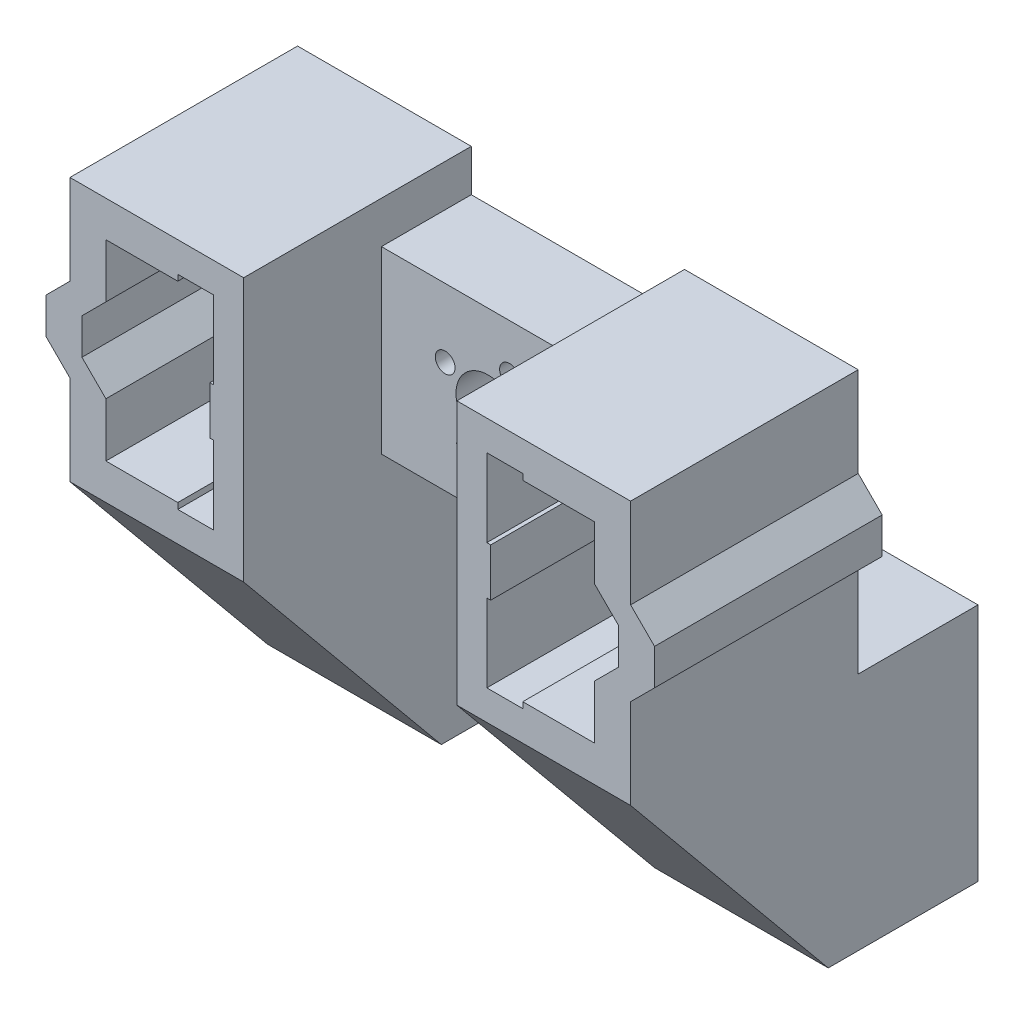
from build123d import *

# Parameters (mm, degrees)
CROQUIS1_R               = 6
SALIENTE_EXTRUIR1_DEPTH  = 38
CROQUIS4_R               = 4.75
SALIENTE_EXTRUIR3_DEPTH  = 5
CROQUIS7_R               = 6
CROQUIS7_R_2             = 5.35
SALIENTE_EXTRUIR4_DEPTH  = 38
CROQUIS8_R               = 1.65
CORTAR_EXTRUIR3_DEPTH    = 38
CROQUIS9_W               = 35.6
CROQUIS9_H               = 23
CORTAR_EXTRUIR4_DEPTH    = 74.441405215
CROQUIS10_W              = 93.6
CROQUIS10_H              = 5
SALIENTE_EXTRUIR5_DEPTH  = 40
CROQUIS11_R              = 2.25
CORTAR_EXTRUIR5_DEPTH    = 87.681255182
CROQUIS14_R              = 2.25
SALIENTE_EXTRUIR6_DEPTH  = 20
SALIENTE_EXTRUIR7_START  = -29
SALIENTE_EXTRUIR7_DEPTH  = 29
SALIENTE_EXTRUIR8_START  = -29
SALIENTE_EXTRUIR8_DEPTH  = 29
CROQUIS17_W              = 35.6
CROQUIS17_H              = 10
CORTAR_EXTRUIR6_DEPTH    = 40
CROQUIS23_W              = 45.6
CROQUIS23_H              = 10
SALIENTE_EXTRUIR11_DEPTH = 8
CORTAR_EXTRUIR7_DEPTH    = 104.464776615
REDONDEO4_R              = 10
SALIENTE_EXTRUIR12_DEPTH = 35.6


with BuildPart() as part:
    # Croquis1 → Saliente-Extruir1 (new body)
    with BuildSketch(Plane.XY):
        Polygon((-50.8, -3), (-50.8, 3), (-46.8, 7), (-46.8, 22), (-17.8, 22), (-17.8, 15), (17.8, 15), (17.8, 22), (46.8, 22), (46.8, 7), (50.8, 3), (50.8, -3), (46.8, -7), (46.8, -22), (17.8, -22), (17.8, -15), (-17.8, -15), (-17.8, -22), (-46.8, -22), (-46.8, -7), align=None)
        Circle(CROQUIS1_R, mode=Mode.SUBTRACT)
        Polygon((-22.8, 4), (-23.45, 4), (-23.45, -4), (-22.8, -4), (-22.8, -17), (-28.8, -17), (-28.8, -16), (-40.8, -16), (-40.8, -7), (-44.8, -3), (-44.8, 3), (-40.8, 7), (-40.8, 16), (-28.8, 16), (-28.8, 17), (-22.8, 17), align=None, mode=Mode.SUBTRACT)
        Polygon((23.45, -4), (23.45, 4), (22.8, 4), (22.8, 17), (28.8, 17), (28.8, 16), (40.8, 16), (40.8, 7), (44.8, 3), (44.8, -3), (40.8, -7), (40.8, -16), (28.8, -16), (28.8, -17), (22.8, -17), (22.8, -4), align=None, mode=Mode.SUBTRACT)
    extrude(amount=SALIENTE_EXTRUIR1_DEPTH)

    # Croquis4 → Saliente-Extruir3 (add)
    # profile 1 of 2: a face of its own
    with BuildSketch(Plane(origin=(0, 0, 0), x_dir=(-1, 0, 0), z_dir=(0, 0, -1))):
        Polygon((-40.8, 16), (-28.8, 16), (-28.8, 17), (-22.8, 17), (-22.8, 4), (-23.45, 4), (-23.45, -4), (-22.8, -4), (-22.8, -17), (-28.8, -17), (-28.8, -16), (-40.8, -16), (-40.8, -7), (-44.8, -3), (-44.8, 3), (-40.8, 7), align=None)
        with Locations((-33.8, 0)):
            Circle(CROQUIS4_R, mode=Mode.SUBTRACT)
    # profile 2 of 2: a face of its own
    with BuildSketch(Plane(origin=(0, 0, 0), x_dir=(-1, 0, 0), z_dir=(0, 0, -1))):
        Polygon((40.8, 7), (40.8, 16), (28.8, 16), (28.8, 17), (22.8, 17), (22.8, 4), (23.45, 4), (23.45, -4), (22.8, -4), (22.8, -17), (28.8, -17), (28.8, -16), (40.8, -16), (40.8, -7), (44.8, -3), (44.8, 3), align=None)
        with Locations(Location((33.8, 0, 0), (0, 0, 180))):
            Circle(CROQUIS4_R, mode=Mode.SUBTRACT)
    extrude(amount=-SALIENTE_EXTRUIR3_DEPTH)

    # Croquis7 → Saliente-Extruir4 (add)
    with BuildSketch(Plane(origin=(0, 0, 0), x_dir=(-1, 0, 0), z_dir=(0, 0, -1))):
        Circle(CROQUIS7_R)
        Circle(CROQUIS7_R_2, mode=Mode.SUBTRACT)
    extrude(amount=-SALIENTE_EXTRUIR4_DEPTH)

    # Croquis8 → Cortar-Extruir3 (cut)
    with BuildSketch(Plane(origin=(0, 0, 0), x_dir=(-1, 0, 0), z_dir=(0, 0, -1))):
        with Locations((-7.15441776, -3.579707868)):
            Circle(CROQUIS8_R)
        with Locations((3.579707868, -7.15441776)):
            Circle(CROQUIS8_R)
        with Locations((7.15441776, 3.579707868)):
            Circle(CROQUIS8_R)
        with Locations((-3.579707868, 7.15441776)):
            Circle(CROQUIS8_R)
    extrude(amount=-CORTAR_EXTRUIR3_DEPTH, mode=Mode.SUBTRACT)

    # Croquis9 → Cortar-Extruir4 (cut, through all)
    with BuildSketch(Plane.XZ.offset(15)):
        with Locations((0, 26.5)):
            Rectangle(CROQUIS9_W, CROQUIS9_H)
    extrude(amount=-CORTAR_EXTRUIR4_DEPTH, mode=Mode.SUBTRACT)

    # Croquis10 → Saliente-Extruir5 (add)
    with BuildSketch(Plane.XZ.offset(22)):
        with Locations((0, 2.5)):
            Rectangle(CROQUIS10_W, CROQUIS10_H)
    extrude(amount=SALIENTE_EXTRUIR5_DEPTH)

    # Croquis11 → Cortar-Extruir5 (cut, through all)
    with BuildSketch(Plane.XY.offset(5)):
        with Locations((0, -35)):
            Circle(CROQUIS11_R)
        with Locations((0, -49)):
            Circle(CROQUIS11_R)
    extrude(amount=-CORTAR_EXTRUIR5_DEPTH, mode=Mode.SUBTRACT)

    # Croquis14 → Saliente-Extruir6 (add)
    with BuildSketch(Plane(origin=(0, 0, 0), x_dir=(-1, 0, 0), z_dir=(0, 0, -1))):
        Polygon((17.8, -22), (46.8, -22), (46.8, -62), (-46.8, -62), (-46.8, -22), align=None)
        with Locations(Location((0, -35, 0), (0, 0, 180))):
            Circle(CROQUIS14_R, mode=Mode.SUBTRACT)
        with Locations(Location((0, -49, 0), (0, 0, 180))):
            Circle(CROQUIS14_R, mode=Mode.SUBTRACT)
    extrude(amount=SALIENTE_EXTRUIR6_DEPTH)

    # Croquis15 → Saliente-Extruir7 (add)
    with BuildSketch(Plane.ZY.offset(46.8).offset(SALIENTE_EXTRUIR7_START)):
        Polygon((38, -22), (5, -62), (5, -22), align=None)
    extrude(amount=SALIENTE_EXTRUIR7_DEPTH)

    # Croquis16 → Saliente-Extruir8 (add)
    with BuildSketch(Plane(origin=(46.8, 0, 0), x_dir=(0, 0, -1), z_dir=(1, 0, 0)).offset(SALIENTE_EXTRUIR8_START)):
        Polygon((-38, -22), (-5, -62), (-5, -22), align=None)
    extrude(amount=SALIENTE_EXTRUIR8_DEPTH)

    # Croquis17 → Cortar-Extruir6 (cut)
    with BuildSketch(Plane.XZ.offset(62)):
        Rectangle(CROQUIS17_W, CROQUIS17_H)
    extrude(amount=-CORTAR_EXTRUIR6_DEPTH, mode=Mode.SUBTRACT)

    # Croquis23 → Saliente-Extruir11 (add)
    with BuildSketch(Plane(origin=(0, -22, 0), x_dir=(1, 0, 0), z_dir=(0, 1, 0))):
        with Locations((0, 5)):
            Rectangle(CROQUIS23_W, CROQUIS23_H)
    extrude(amount=SALIENTE_EXTRUIR11_DEPTH)

    # Croquis24 → Cortar-Extruir7 (cut, through all)
    with BuildSketch(Plane.ZY.offset(22.8)):
        Polygon((-10, -22), (0, -14), (-10, -14), align=None)
    extrude(amount=-CORTAR_EXTRUIR7_DEPTH, mode=Mode.SUBTRACT)

    # Redondeo4
    # the kernel refuses this fillet: 10 mm, written as the material it takes off along each edge
    with BuildSketch(Plane(origin=(-22.8, -37.617376189, -29.521720236), x_dir=(1, 0, 0), z_dir=(0, 0.6246950475544245, 0.7808688094430302))) as redondeo4_piece_1_section:
        with BuildLine():
            CenterArc((REDONDEO4_R, -REDONDEO4_R), REDONDEO4_R, 90, 90)
            Line((0, -REDONDEO4_R), (0, 0))
            Line((0, 0), (REDONDEO4_R, 0))
        make_face()
    redondeo4_piece_1 = extrude(amount=62.806248475, mode=Mode.PRIVATE)
    redondeo4_piece_1 = split(redondeo4_piece_1, bisect_by=Plane(origin=(-20.122466275, -22, -4.721973229), z_dir=(0, 1, 0)), keep=Keep.TOP, mode=Mode.PRIVATE)
    redondeo4_piece_1 = split(redondeo4_piece_1, bisect_by=Plane(origin=(-20.122466275, -19.662128578, 0), z_dir=(0, 0, -1)), keep=Keep.TOP, mode=Mode.PRIVATE)
    add(redondeo4_piece_1, mode=Mode.SUBTRACT)
    with BuildSketch(Plane(origin=(22.8, -37.617376189, -29.521720236), x_dir=(0, -0.7808688094430302, 0.6246950475544245), z_dir=(0, 0.6246950475544245, 0.7808688094430302))) as redondeo4_piece_2_section:
        with BuildLine():
            CenterArc((REDONDEO4_R, -REDONDEO4_R), REDONDEO4_R, 90, 90)
            Line((0, -REDONDEO4_R), (0, 0))
            Line((0, 0), (REDONDEO4_R, 0))
        make_face()
    redondeo4_piece_2 = extrude(amount=62.806248475, mode=Mode.PRIVATE)
    redondeo4_piece_2 = split(redondeo4_piece_2, bisect_by=Plane(origin=(20.122466276, -22, -4.72197323), z_dir=(0, 1, 0)), keep=Keep.TOP, mode=Mode.PRIVATE)
    redondeo4_piece_2 = split(redondeo4_piece_2, bisect_by=Plane(origin=(20.122466276, -19.662128579, 0), z_dir=(0, 0, -1)), keep=Keep.TOP, mode=Mode.PRIVATE)
    add(redondeo4_piece_2, mode=Mode.SUBTRACT)

    # Croquis25 → Saliente-Extruir12 (add)
    with BuildSketch(Plane.ZY.offset(-17.8)):
        Polygon((0, -22), (15, -15), (0, -15), align=None)
    extrude(amount=SALIENTE_EXTRUIR12_DEPTH)


solid = part.part
